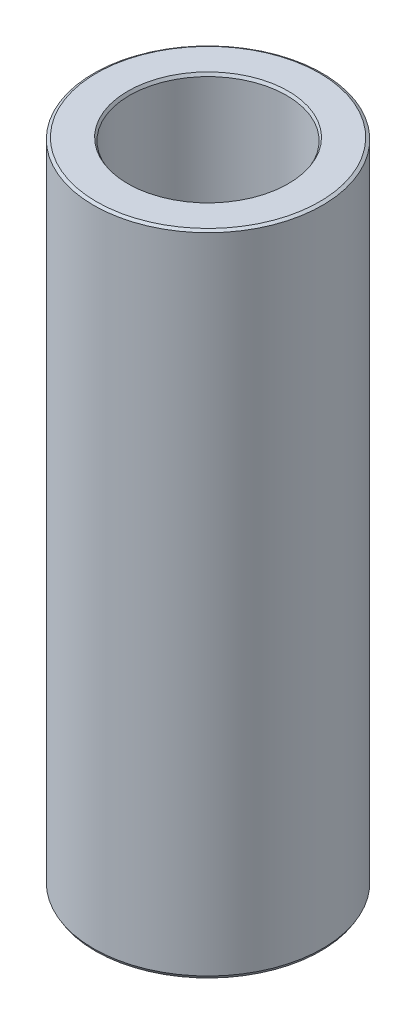
from build123d import *
from OCP.BRepFilletAPI import BRepFilletAPI_MakeChamfer

# Parameters (mm, degrees)
SKETCH1_R           = 52.5
BOSS_EXTRUDE1_DEPTH = 297.531425897
SKETCH2_R           = 36.066562476
CUT_EXTRUDE1_DEPTH  = 307.655261485
CHAMFER1_SIZE       = 0.766780315
CHAMFER1_SIZE2      = 1.328102463


with BuildPart() as part:
    # Sketch1 → Boss-Extrude1 (new body)
    with BuildSketch(Plane(origin=(0, 0, 0), x_dir=(1, 0, 0), z_dir=(0, 1, 0))):
        Circle(SKETCH1_R)
    extrude(amount=BOSS_EXTRUDE1_DEPTH)

    # Sketch2 → Cut-Extrude1 (cut, through all)
    with BuildSketch(Plane(origin=(0, 0, 0), x_dir=(1, 0, 0), z_dir=(0, 1, 0))):
        Circle(SKETCH2_R)
    extrude(amount=CUT_EXTRUDE1_DEPTH, mode=Mode.SUBTRACT)

    # Chamfer1: one chamfer whose edges measure the first distance from different faces: ONE call of the kernel's chamfer builder (chamfer() names one face for all edges)
    chamfer1_edges_1 = [part.edges().sort_by_distance(p)[0] for p in [
        (-36.066562476, 297.531425897, 0),
    ]]
    chamfer1_side_1 = [part.faces().sort_by_distance(p)[0] for p in [
        (-51.01507576, 297.531425897, 0),
    ]]
    chamfer1_edges_2 = [part.edges().sort_by_distance(p)[0] for p in [
        (-36.066562476, 0, 0),
    ]]
    chamfer1_side_2 = [part.faces().sort_by_distance(p)[0] for p in [
        (-36.066562476, 148.765712948, 0),
    ]]
    chamfer1_edges_3 = [part.edges().sort_by_distance(p)[0] for p in [
        (-52.5, 0, 0),
    ]]
    chamfer1_side_3 = [part.faces().sort_by_distance(p)[0] for p in [
        (-51.01507576, 0, 0),
    ]]
    chamfer1_edges_4 = [part.edges().sort_by_distance(p)[0] for p in [
        (-52.5, 297.531425897, 0),
    ]]
    chamfer1_side_4 = [part.faces().sort_by_distance(p)[0] for p in [
        (-52.5, 148.765712948, 0),
    ]]
    chamfer1 = BRepFilletAPI_MakeChamfer(part.part.solid().wrapped)
    for e in chamfer1_edges_1:
        chamfer1.Add(CHAMFER1_SIZE, CHAMFER1_SIZE2, e.wrapped, chamfer1_side_1[0].wrapped)  # the first distance lies on this face
    for e in chamfer1_edges_2:
        chamfer1.Add(CHAMFER1_SIZE, CHAMFER1_SIZE2, e.wrapped, chamfer1_side_2[0].wrapped)  # the first distance lies on this face
    for e in chamfer1_edges_3:
        chamfer1.Add(CHAMFER1_SIZE, CHAMFER1_SIZE2, e.wrapped, chamfer1_side_3[0].wrapped)  # the first distance lies on this face
    for e in chamfer1_edges_4:
        chamfer1.Add(CHAMFER1_SIZE, CHAMFER1_SIZE2, e.wrapped, chamfer1_side_4[0].wrapped)  # the first distance lies on this face
    add(Compound.cast(chamfer1.Shape()), mode=Mode.REPLACE)


solid = part.part
